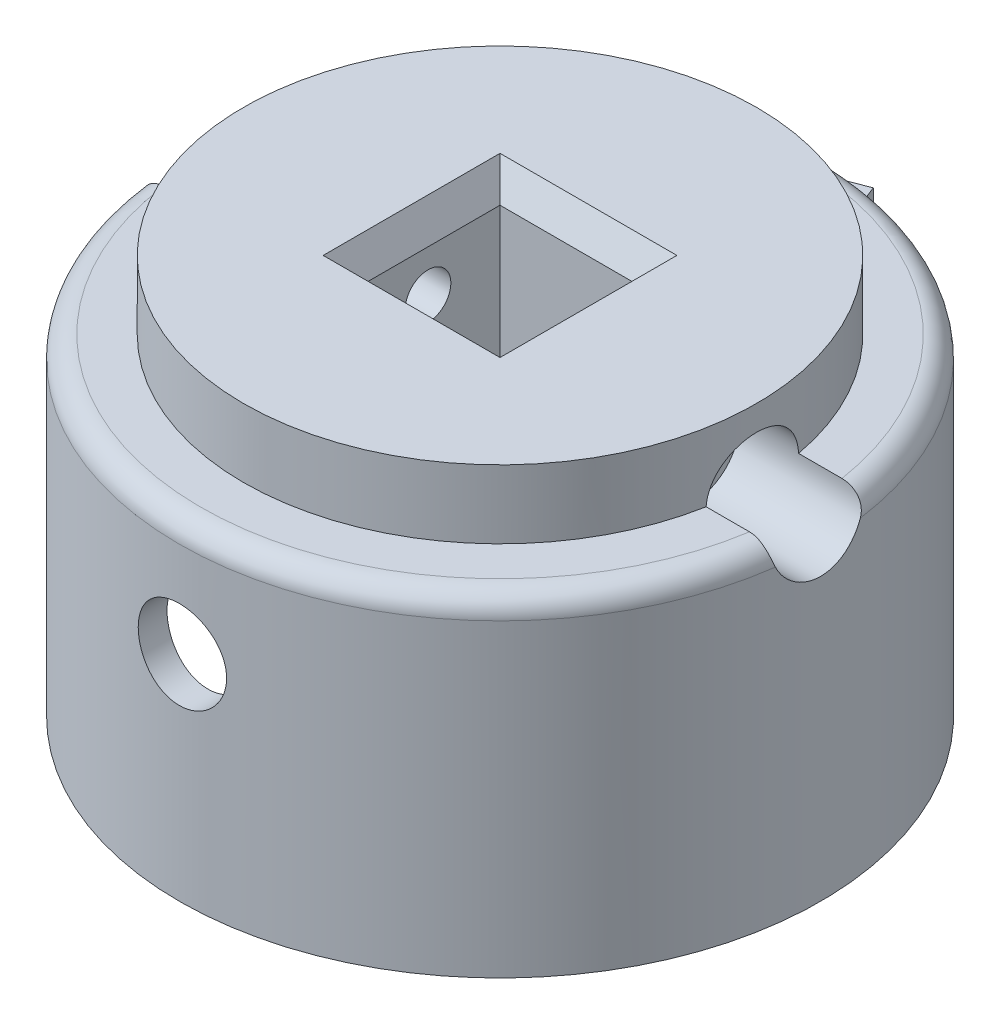
from build123d import *
from OCP.BRepFilletAPI import BRepFilletAPI_MakeChamfer

# Parameters (mm, degrees)
SKETCH1_R                = 22.5
BOSS_EXTRUDE1_DEPTH      = 28
SKETCH2_W                = 10.1
SKETCH2_H                = 10.1
CUT_EXTRUDE2_DEPTH       = 43.385138905
SHELL3_T                 = -2
SKETCH3_R                = 3.1
CUT_EXTRUDE3_DEPTH       = 47.51292831
CHAMFER1_SIZE            = 2
CHAMFER1_SIZE2           = 1.154700538
BOSS_EXTRUDE8_START      = 23
BOSS_EXTRUDE8_DEPTH      = 23
BOSS_EXTRUDE4_DEPTH      = 20
BOSS_EXTRUDE6_DEPTH      = 26
CUT_EXTRUDE5_DEPTH       = 12
SKETCH13_R               = 3.8
CUT_EXTRUDE6_DEPTH       = 16
SKETCH15_W               = 10
SKETCH15_H               = 3
CUT_EXTRUDE8_DEPTH       = 16
CUT_EXTRUDE9_DEPTH       = 2
BOSS_EXTRUDE10_START     = 7
BOSS_EXTRUDE10_DEPTH     = 7
SKETCH21_OUTSIDE_W       = 61.262
SKETCH21_OUTSIDE_H       = 63.965
SKETCH21_OUTSIDE_R       = 18
CUT_EXTRUDE11_DEPTH      = 4.8
CUT_EXTRUDE12_DEPTH      = 47.67125763
CUT_EXTRUDE12_DEPTH_BACK = 47.67125763
SKETCH22_R               = 1.6
CUT_EXTRUDE13_START      = -8.5
SKETCH24_R               = 3.25
CUT_EXTRUDE13_DEPTH      = 39.17125769
CUT_EXTRUDE14_START      = -8.5
CUT_EXTRUDE14_DEPTH      = 39.171257692
FILLET1_R                = 1.5
CHAMFER2_SIZE            = 0.5
CHAMFER2_SIZE2           = 1.37373871


with BuildPart() as part:
    # Sketch1 → Boss-Extrude1 (new body)
    with BuildSketch(Plane(origin=(0, 0, 0), x_dir=(1, 0, 0), z_dir=(0, 1, 0))):
        with Locations(Location((0, 0, 0), (0, 0, 270))):
            Circle(SKETCH1_R)
    extrude(amount=BOSS_EXTRUDE1_DEPTH)

    # Sketch2 → Cut-Extrude2 (cut, through all)
    with BuildSketch(Plane.XZ):
        Rectangle(SKETCH2_W, SKETCH2_H)
    extrude(amount=-CUT_EXTRUDE2_DEPTH, mode=Mode.SUBTRACT)

    # Shell3
    shell3_openings = [part.faces().sort_by_distance(p)[0] for p in [
        (0, 0, -21.863603897),
    ]]
    offset(amount=SHELL3_T, openings=shell3_openings, kind=Kind.INTERSECTION)

    # Sketch3 → Cut-Extrude3 (cut, through all)
    with BuildSketch(Plane.XY.offset(7.05)):
        with Locations(Location((0, 15, 0), (0, 0, 270.000000016))):
            Circle(SKETCH3_R)
    extrude(amount=CUT_EXTRUDE3_DEPTH, mode=Mode.SUBTRACT)

    # Chamfer1: one chamfer whose edges measure the first distance from different faces: ONE call of the kernel's chamfer builder (chamfer() names one face for all edges)
    chamfer1_edges_1 = [part.edges().sort_by_distance(p)[0] for p in [
        (5.05, 28, 0),
    ]]
    chamfer1_side_1 = [part.faces().sort_by_distance(p)[0] for p in [
        (5.05, 14, 0),
    ]]
    chamfer1_edges_2 = [part.edges().sort_by_distance(p)[0] for p in [
        (0, 28, -5.05),
    ]]
    chamfer1_side_2 = [part.faces().sort_by_distance(p)[0] for p in [
        (0, 14, -5.05),
    ]]
    chamfer1_edges_3 = [part.edges().sort_by_distance(p)[0] for p in [
        (-5.05, 28, 0),
    ]]
    chamfer1_side_3 = [part.faces().sort_by_distance(p)[0] for p in [
        (-5.05, 14, 0),
    ]]
    chamfer1_edges_4 = [part.edges().sort_by_distance(p)[0] for p in [
        (0, 28, 5.05),
    ]]
    chamfer1_side_4 = [part.faces().sort_by_distance(p)[0] for p in [
        (0, 14, 5.05),
    ]]
    chamfer1 = BRepFilletAPI_MakeChamfer(part.part.solid().wrapped)
    for e in chamfer1_edges_1:
        chamfer1.Add(CHAMFER1_SIZE, CHAMFER1_SIZE2, e.wrapped, chamfer1_side_1[0].wrapped)  # the first distance lies on this face
    for e in chamfer1_edges_2:
        chamfer1.Add(CHAMFER1_SIZE, CHAMFER1_SIZE2, e.wrapped, chamfer1_side_2[0].wrapped)  # the first distance lies on this face
    for e in chamfer1_edges_3:
        chamfer1.Add(CHAMFER1_SIZE, CHAMFER1_SIZE2, e.wrapped, chamfer1_side_3[0].wrapped)  # the first distance lies on this face
    for e in chamfer1_edges_4:
        chamfer1.Add(CHAMFER1_SIZE, CHAMFER1_SIZE2, e.wrapped, chamfer1_side_4[0].wrapped)  # the first distance lies on this face
    add(Compound.cast(chamfer1.Shape()), mode=Mode.REPLACE)

    # Sketch18 → Boss-Extrude8 (add)
    with BuildSketch(Plane.XZ.offset(-26).offset(BOSS_EXTRUDE8_START)):
        with BuildLine():
            Line((-15.72889581, -7.671495069), (-18.425277949, -8.986608509))
            ThreePointArc((-18.425277949, -8.986608509), (-20.471905462, 1.072887103), (-17.384985971, 10.863344917))
            Line((-17.384985971, 10.863344917), (-14.840841683, 9.273587124))
            ThreePointArc((-14.840841683, 9.273587124), (-17.476016858, 0.915879234), (-15.72889581, -7.671495069))
        make_face()
    extrude(amount=-BOSS_EXTRUDE8_DEPTH)

    # Sketch9 → Boss-Extrude4 (add)
    with BuildSketch(Plane.XZ):
        Polygon((2.070380013, -22.404542544), (-16.587666088, -15.201951643), (-17.668054723, -18.000658558), (0.989991378, -25.203249459), align=None)
    extrude(amount=-BOSS_EXTRUDE4_DEPTH)

    # Sketch11 → Boss-Extrude6 (add)
    with BuildSketch(Plane.XZ):
        with BuildLine():
            Line((2.070380013, -22.404542544), (7.05, -7.05))
            Line((7.05, -7.05), (-7.05, -7.05))
            Line((-7.05, -7.05), (-16.587666088, -15.201951643))
            ThreePointArc((-16.587666088, -15.201951643), (-8.102914764, -20.990301864), (2.070380013, -22.404542544))
        make_face()
    extrude(amount=-BOSS_EXTRUDE6_DEPTH)

    # Sketch12 → Cut-Extrude5 (cut)
    with BuildSketch(Plane.XZ):
        with BuildLine():
            Line((3.795196001, -17.086112517), (2.74804579, -20.314975863))
            ThreePointArc((2.74804579, -20.314975863), (-6.94389773, -19.288138436), (-15.066327631, -13.901646367))
            Line((-15.066327631, -13.901646367), (-12.785820172, -11.952470714))
            ThreePointArc((-12.785820172, -11.952470714), (-5.176523958, -16.719520129), (3.795196001, -17.086112517))
        make_face()
    extrude(amount=-CUT_EXTRUDE5_DEPTH, mode=Mode.SUBTRACT)

    # Sketch13 → Cut-Extrude6 (cut)
    with BuildSketch(Plane(origin=(-8.339031673, 0, -21.601954009), x_dir=(-0.9329023050578704, 0, 0.36012954504971145), z_dir=(-0.36012954504971145, 0, -0.9329023050578704))):
        with Locations((0, 10)):
            Circle(SKETCH13_R)
    extrude(amount=-CUT_EXTRUDE6_DEPTH, mode=Mode.SUBTRACT)

    # Sketch15 → Cut-Extrude8 (cut)
    with BuildSketch(Plane(origin=(-8.339031673, 0, -21.601954009), x_dir=(-0.9329023050578704, 0, 0.36012954504971145), z_dir=(-0.36012954504971145, 0, -0.9329023050578704))):
        with Locations((0, 10)):
            Rectangle(SKETCH15_W, SKETCH15_H)
    extrude(amount=-CUT_EXTRUDE8_DEPTH, mode=Mode.SUBTRACT)

    # Sketch17 → Cut-Extrude9 (cut)
    with BuildSketch(Plane.XZ):
        with BuildLine():
            Line((7.05, 7.05), (7.05, -7.05))
            Line((7.05, -7.05), (3.795196001, -17.086112517))
            ThreePointArc((3.795196001, -17.086112517), (-5.176523958, -16.719520129), (-12.785820172, -11.952470714))
            Line((-12.785820172, -11.952470714), (-7.05, -7.05))
            Line((-7.05, -7.05), (-7.05, 7.05))
            Line((-7.05, 7.05), (7.05, 7.05))
        make_face()
    extrude(amount=-CUT_EXTRUDE9_DEPTH, mode=Mode.SUBTRACT)

    # Sketch20 → Boss-Extrude10 (add)
    with BuildSketch(Plane.XZ.offset(-26).offset(BOSS_EXTRUDE10_START)):
        with BuildLine():
            Line((2.74804579, -20.314975863), (7.05, -7.05))
            Line((7.05, -7.05), (7.05, 7.05))
            Line((7.05, 7.05), (-7.05, 7.05))
            Line((-7.05, 7.05), (-7.05, -7.05))
            Line((-7.05, -7.05), (-15.066327631, -13.901646367))
            ThreePointArc((-15.066327631, -13.901646367), (6.94389773, 19.288138436), (2.74804579, -20.314975863))
        make_face()
    extrude(amount=-BOSS_EXTRUDE10_DEPTH)

    # Sketch21 outside → Cut-Extrude11 (cut)
    with BuildSketch(Plane(origin=(0, 28, 0), x_dir=(1, 0, 0), z_dir=(0, 1, 0))):
        with Locations((0, 1.3515)):
            Rectangle(SKETCH21_OUTSIDE_W, SKETCH21_OUTSIDE_H)
        with Locations(Location((0, 0, 0), (0, 0, 270))):
            Circle(SKETCH21_OUTSIDE_R, mode=Mode.SUBTRACT)
    extrude(amount=-CUT_EXTRUDE11_DEPTH, mode=Mode.SUBTRACT)

    # Sketch22 → Cut-Extrude12 (cut, two sides: drawn at the far end of the back side and taken through both)
    with BuildSketch(Plane.ZY.offset(-5.05).offset(-CUT_EXTRUDE12_DEPTH_BACK)):
        with Locations((0, 23)):
            Circle(SKETCH22_R)
    extrude(amount=CUT_EXTRUDE12_DEPTH + CUT_EXTRUDE12_DEPTH_BACK, mode=Mode.SUBTRACT)

    # Sketch24 → Cut-Extrude13 (cut, through all)
    with BuildSketch(Plane.ZY.offset(-5.05).offset(CUT_EXTRUDE13_START)):
        with Locations((0, 23)):
            Circle(SKETCH24_R)
    extrude(amount=-CUT_EXTRUDE13_DEPTH, mode=Mode.SUBTRACT)

    # Sketch25 → Cut-Extrude14 (cut, through all)
    with BuildSketch(Plane(origin=(-5.05, 0, 0), x_dir=(0, 0, -1), z_dir=(1, 0, 0)).offset(CUT_EXTRUDE14_START)):
        Polygon((0, 19.75), (2.814582562, 21.375), (2.814582562, 24.625), (0, 26.25), (-2.814582562, 24.625), (-2.814582562, 21.375), align=None)
    extrude(amount=-CUT_EXTRUDE14_DEPTH, mode=Mode.SUBTRACT)

    # Fillet1
    # the kernel refuses this fillet: 1.5 mm, written as the material it takes off along each edge
    with BuildSketch(Plane(origin=(0, 23.2, 0), x_dir=(0, 0, 1), z_dir=(1, 0, 0))) as fillet1_piece_1:
        with BuildLine():
            CenterArc((22.5 - FILLET1_R, FILLET1_R), FILLET1_R, 270, 90)
            Line((22.5, FILLET1_R), (22.5, 0))
            Line((22.5, 0), (22.5 - FILLET1_R, 0))
        make_face()
    revolve(axis=Axis((0, 23.2, 0), (0, -1, 0)), revolution_arc=92.366443414, mode=Mode.SUBTRACT)
    with BuildSketch(Plane(origin=(0, 23.2, 0), x_dir=(-0.9991402664664062, 0, 0.041457543649361384), z_dir=(0.041457543649361384, 0, 0.9991402664664062))) as fillet1_piece_2:
        with BuildLine():
            CenterArc((22.5 - FILLET1_R, FILLET1_R), FILLET1_R, 270, 90)
            Line((22.5, FILLET1_R), (22.5, 0))
            Line((22.5, 0), (22.5 - FILLET1_R, 0))
        make_face()
    revolve(axis=Axis((0, 23.2, 0), (0, -1, 0)), revolution_arc=183.648889302, mode=Mode.SUBTRACT)
    with BuildSketch(Plane(origin=(0, 23.2, 0), x_dir=(0.9997569746526436, 0, -0.022045217925738058), z_dir=(-0.022045217925738058, 0, -0.9997569746526436))) as fillet1_piece_3:
        with BuildLine():
            CenterArc((22.5 - FILLET1_R, FILLET1_R), FILLET1_R, 270, 90)
            Line((22.5, FILLET1_R), (22.5, 0))
            Line((22.5, 0), (22.5 - FILLET1_R, 0))
        make_face()
    revolve(axis=Axis((0, 23.2, 0), (0, -1, 0)), revolution_arc=91.263200277, mode=Mode.SUBTRACT)

    # Chamfer2
    chamfer2_edges = [part.edges().sort_by_distance(p)[0] for p in [
        (0, 2, 5.05),
        (-5.05, 2, 0),
        (0, 2, -5.05),
        (5.05, 2, 0),
    ]]
    chamfer2_side = [part.faces().sort_by_distance(p)[0] for p in [
        (-1.341973038, 2, -7.273001119),
    ]]
    chamfer(chamfer2_edges, length=CHAMFER2_SIZE, length2=CHAMFER2_SIZE2, reference=chamfer2_side[0])


solid = part.part
